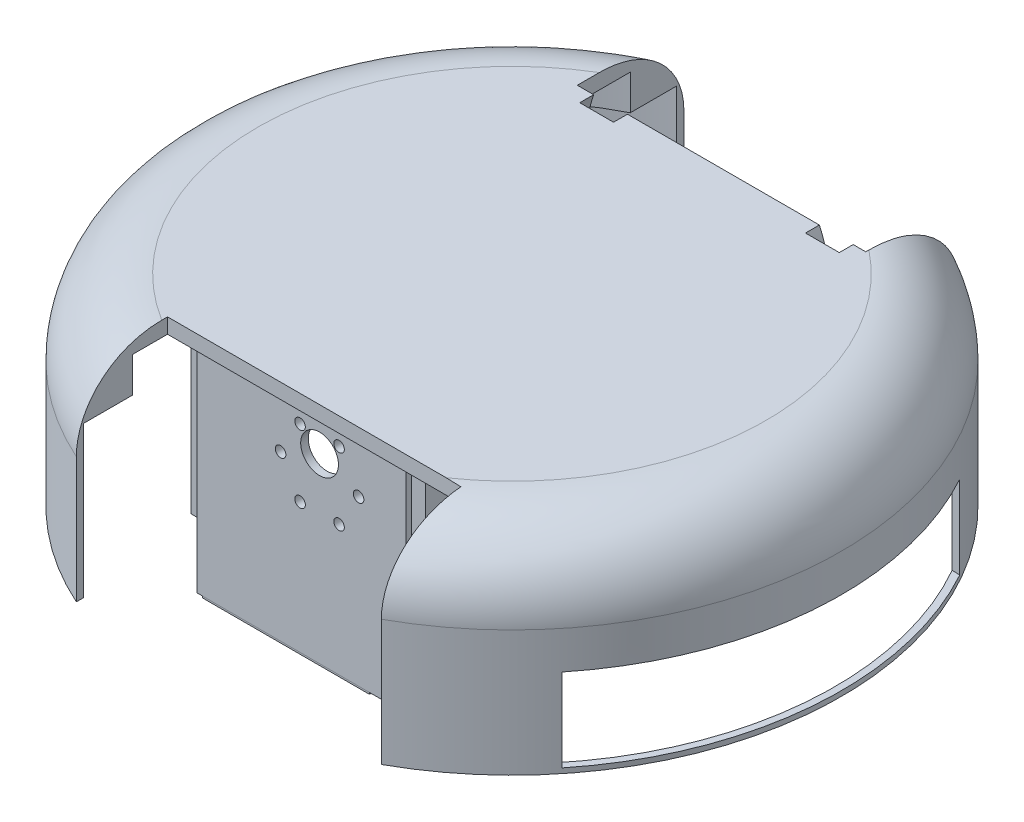
from build123d import *

# Parameters (mm, degrees)
MOTORHOLDERS_DEPTH               = 80
MOTORHOLDERS_DEPTH_BACK          = 80
MOTORHOLDERSSKETCH_R             = 23.41
SKETCH4_W                        = 262.774983374
SKETCH4_H                        = 153.112553215
CUT_EXTRUDE1_DEPTH               = 26
SKETCH53_R                       = 128.324079141
BOTTOMPLATECUTFORTHEINSIDE_DEPTH = 60
FILLET2_R                        = 30
SKETCH57_R                       = 110.374622245
CUTFORTHEINSIDE2_DEPTH           = 14
SKETCH23_W                       = 82.936115801
SKETCH23_H                       = 87.063331284
MOTORMOUNTINGSUPPORT1_DEPTH      = 6
SKETCH24_W                       = 62.643465408
SKETCH24_H                       = 86.363062387
MOTORMOUNTINGSUPPOR2_DEPTH       = 6
SKETCH17_R                       = 2.1
SKETCH17_R_2                     = 7.5
MOTORHOLES1_DEPTH                = 31.5
CUT_EXTRUDE4_START               = -30
SKETCH19_R                       = 2.1
SKETCH19_R_2                     = 7.5
CUT_EXTRUDE4_DEPTH               = 30
CELLPHONEPLATE_DEPTH             = 1.5
CELLPHONEPLATE_DEPTH_BACK        = 2.5
SKETCH28_W                       = 66.387115975
SKETCH28_H                       = 157.698901517
MOTORHOLDERCUT_DEPTH             = 77
MOTORHOLDERCUT_DEPTH_BACK        = 77
MOTORHOLDEREXTRUDESKETCH_R       = 20.415
SKETCH54_W                       = 14.905504957
SKETCH54_H                       = 17.743992054
SKETCH54_W_2                     = 11.623155669
SKETCH54_H_2                     = 15.406590489
SKETCH54_W_3                     = 15.41217296
SKETCH54_H_3                     = 20.336661001
SKETCH54_W_4                     = 14.995116458
SKETCH54_H_4                     = 28.496316742
BOSS_EXTRUDE12_DEPTH             = 60
POWERBANKCUT_DEPTH               = 33
CUT_EXTRUDE11_DEPTH              = 10
CUT_EXTRUDE11_DEPTH_BACK         = 5
SKETCH43_R                       = 54.5
SKETCH43_R_2                     = 42
WHEELOPENINGS_DEPTH              = 332.549853827
WHEELOPENINGS_DEPTH_BACK         = 332.549853827
SKETCH46_W                       = 116.594199343
SKETCH46_H                       = 125.693747757
SKETCH46_W_2                     = 114.657260807
SKETCH46_H_2                     = 111.481493264
CUT_EXTRUDE23_DEPTH              = 5
CUT_EXTRUDE23_DEPTH_BACK         = 45
SKETCH55_W                       = 110.87314981
SKETCH55_H                       = 156.298500792


with BuildPart() as part:
    # MotorHoldersSketch → MotorHolders (new, two sides: drawn at the far end of the back side and taken through both)
    with BuildSketch(Plane.XY.offset(-MOTORHOLDERS_DEPTH_BACK)):
        with Locations((170, 0)):
            Circle(MOTORHOLDERSSKETCH_R)
    extrude(amount=MOTORHOLDERS_DEPTH + MOTORHOLDERS_DEPTH_BACK)

    # Sketch4 → Cut-Extrude1 (cut)
    with BuildSketch(Plane(origin=(0, 0, 0), x_dir=(1, 0, 0), z_dir=(0, 1, 0))):
        with Locations((89.893628689, 0.176832173)):
            Rectangle(SKETCH4_W, SKETCH4_H)
    extrude(amount=-CUT_EXTRUDE1_DEPTH, mode=Mode.SUBTRACT)

    # BottomPlate: read off the stored shape, not the designer's step
    # BottomPlate: loft between two sections, ruled curve by curve
    bottomplate_from = [
        Edge.make_three_point_arc((163.830273897, -55.425, 128.360817568), (294.830273897, -55.425, -2.639182432), (163.830273897, -55.425, -133.639182432)),
        Edge.make_three_point_arc((163.830273897, -55.425, -133.639182432), (32.830273897, -55.425, -2.639182432), (163.830273897, -55.425, 128.360817568)),
    ]
    bottomplate_to = [
        Edge.make_three_point_arc((163.830273897, 24.575, 128.360817568), (294.830273897, 24.575, -2.639182432), (163.830273897, 24.575, -133.639182432)),
        Edge.make_three_point_arc((163.830273897, 24.575, -133.639182432), (32.830273897, 24.575, -2.639182432), (163.830273897, 24.575, 128.360817568)),
    ]
    bottomplate = Solid(Shell([*[Face.make_surface_from_curves(bottomplate_from[k], bottomplate_to[k]) for k in range(2)], Face(Wire(bottomplate_from)), Face(Wire(bottomplate_to))]))
    add(bottomplate)

    # Sketch53 → BottomPlateCutForTheInside (cut)
    with BuildSketch(Plane.XZ.offset(55.425)):
        with Locations(Location((163.830273897, -2.639182432, 0), (0, 0, 270))):
            Circle(SKETCH53_R)
    extrude(amount=-BOTTOMPLATECUTFORTHEINSIDE_DEPTH, mode=Mode.SUBTRACT)

    # Fillet2
    # the kernel refuses this fillet: 30 mm, written as the material it takes off along each edge
    with BuildSketch(Plane(origin=(163.830273897, 24.575, -2.639182432), x_dir=(0, 0, 1), z_dir=(-1, 0, 0))) as fillet2_piece_1:
        with BuildLine():
            CenterArc((131 - FILLET2_R * 1.00000000132, -FILLET2_R), FILLET2_R, 0, 90)
            Line((131 - FILLET2_R * 1.00000000132, 0), (131, 0))
            Line((131, 0), (131 - FILLET2_R * 1.32132337664e-09, -FILLET2_R))
        make_face()
    revolve(axis=Axis((163.830273897, 24.575, -2.639182432), (0, 1, 0)), revolution_arc=180, mode=Mode.SUBTRACT)
    with BuildSketch(Plane(origin=(163.830273897, 24.575, -2.639182432), x_dir=(0, 0, -1), z_dir=(1, 0, 0))) as fillet2_piece_2:
        with BuildLine():
            CenterArc((131 - FILLET2_R * 1.00000000132, -FILLET2_R), FILLET2_R, 0, 90)
            Line((131 - FILLET2_R * 1.00000000132, 0), (131, 0))
            Line((131, 0), (131 - FILLET2_R * 1.32132432403e-09, -FILLET2_R))
        make_face()
    revolve(axis=Axis((163.830273897, 24.575, -2.639182432), (0, 1, 0)), revolution_arc=180, mode=Mode.SUBTRACT)

    # Sketch57 → CutForTheInside2 (cut)
    with BuildSketch(Plane.XZ.offset(-4.575)):
        with Locations(Location((161.730665596, -3.091355915, 0), (0, 0, 270))):
            Circle(SKETCH57_R)
    extrude(amount=-CUTFORTHEINSIDE2_DEPTH, mode=Mode.SUBTRACT)

    # Sketch23 → MotorMountingSupport1 (add)
    with BuildSketch(Plane.XY.offset(80)):
        with Locations((162.789906406, -21.691470758)):
            Rectangle(SKETCH23_W, SKETCH23_H)
    extrude(amount=-MOTORMOUNTINGSUPPORT1_DEPTH)

    # Sketch24 → MotorMountingSuppor2 (add)
    with BuildSketch(Plane(origin=(0, 0, -80), x_dir=(-1, 0, 0), z_dir=(0, 0, -1))):
        with Locations((-170.868787608, -23.94412431)):
            Rectangle(SKETCH24_W, SKETCH24_H)
    extrude(amount=-MOTORMOUNTINGSUPPOR2_DEPTH)

    # Sketch17 → MotorHoles1 (cut)
    with BuildSketch(Plane.XY.offset(80)):
        with Locations((185.5, 0)):
            Circle(SKETCH17_R)
        with Locations((177.75, -13.42)):
            Circle(SKETCH17_R)
        with Locations((162.25, -13.42)):
            Circle(SKETCH17_R)
        with Locations((154.5, 0)):
            Circle(SKETCH17_R)
        with Locations((162.25, 13.42)):
            Circle(SKETCH17_R)
        with Locations((177.75, 13.42)):
            Circle(SKETCH17_R)
        with Locations((170, 7)):
            Circle(SKETCH17_R_2)
    extrude(amount=-MOTORHOLES1_DEPTH, mode=Mode.SUBTRACT)

    # Sketch19 → Cut-Extrude4 (cut)
    with BuildSketch(Plane(origin=(0, 0, -80), x_dir=(-1, 0, 0), z_dir=(0, 0, -1)).offset(CUT_EXTRUDE4_START)):
        with Locations(Location((-185.5, 0, 0), (0, 0, 180))):
            Circle(SKETCH19_R)
        with Locations(Location((-177.75, -13.42, 0), (0, 0, 180))):
            Circle(SKETCH19_R)
        with Locations(Location((-162.25, -13.42, 0), (0, 0, 180))):
            Circle(SKETCH19_R)
        with Locations(Location((-154.5, 0, 0), (0, 0, 180))):
            Circle(SKETCH19_R)
        with Locations(Location((-162.25, 13.42, 0), (0, 0, 180))):
            Circle(SKETCH19_R)
        with Locations(Location((-177.75, 13.42, 0), (0, 0, 180))):
            Circle(SKETCH19_R)
        with Locations(Location((-170, 7, 0), (0, 0, 180))):
            Circle(SKETCH19_R_2)
    extrude(amount=CUT_EXTRUDE4_DEPTH, mode=Mode.SUBTRACT)

    # Sketch28 → CellPhonePlate (add, two sides: drawn at the far end of the back side and taken through both)
    with BuildSketch(Plane(origin=(0, -64.829272125, 0), x_dir=(-1, 0, 0), z_dir=(0, -1, 0)).offset(-CELLPHONEPLATE_DEPTH_BACK)):
        with Locations((-156.196154729, -0.699595313)):
            Rectangle(SKETCH28_W, SKETCH28_H)
    extrude(amount=CELLPHONEPLATE_DEPTH + CELLPHONEPLATE_DEPTH_BACK)

    # MotorHolderExtrudeSketch → MotorHolderCut (cut, two sides: drawn at the far end of the back side and taken through both)
    with BuildSketch(Plane.XY.offset(-MOTORHOLDERCUT_DEPTH_BACK)):
        with Locations((170, 0)):
            Circle(MOTORHOLDEREXTRUDESKETCH_R)
    extrude(amount=MOTORHOLDERCUT_DEPTH + MOTORHOLDERCUT_DEPTH_BACK, mode=Mode.SUBTRACT)

    # Sketch54 → Boss-Extrude12 (add)
    with BuildSketch(Plane.XZ.offset(-18.575)):
        with Locations((206.988441473, -69.206857561)):
            Rectangle(SKETCH54_W, SKETCH54_H)
        with Locations((138.923219907, -69.336411659)):
            Rectangle(SKETCH54_W_2, SKETCH54_H_2)
        with Locations((202.073699031, 67.602556792)):
            Rectangle(SKETCH54_W_3, SKETCH54_H_3)
        with Locations((124.209409668, 63.522728921)):
            Rectangle(SKETCH54_W_4, SKETCH54_H_4)
    extrude(amount=BOSS_EXTRUDE12_DEPTH)

    # Sketch11 → PowerBankCut (cut)
    with BuildSketch(Plane(origin=(0, -20.425, 0), x_dir=(1, 0, 0), z_dir=(0, 1, 0))):
        Polygon((55.038885452, -72.893378905), (55.038885452, 75.050788564), (295.013044953, 65.256410745), (295.013044953, -80.378817854), align=None)
    extrude(amount=-POWERBANKCUT_DEPTH, mode=Mode.SUBTRACT)

    # Sketch43 → Cut-Extrude11 (cut, two sides: drawn at the far end of the back side and taken through both)
    with BuildSketch(Plane(origin=(0, 0, -80), x_dir=(-1, 0, 0), z_dir=(0, 0, -1)).offset(-CUT_EXTRUDE11_DEPTH_BACK)):
        with Locations((-170, 7)):
            Circle(SKETCH43_R)
        with Locations((-170, 7)):
            Circle(SKETCH43_R_2, mode=Mode.SUBTRACT)
    extrude(amount=CUT_EXTRUDE11_DEPTH + CUT_EXTRUDE11_DEPTH_BACK, mode=Mode.SUBTRACT)

    # Sketch46 → WheelOpenings (cut, two sides: drawn at the far end of the back side and taken through both)
    with BuildSketch(Plane.XZ.offset(-4.575).offset(-WHEELOPENINGS_DEPTH_BACK)):
        with Locations((168.496318976, 143.484991478)):
            Rectangle(SKETCH46_W, SKETCH46_H)
        with Locations((169.250548927, -136.266708486)):
            Rectangle(SKETCH46_W_2, SKETCH46_H_2)
    extrude(amount=WHEELOPENINGS_DEPTH + WHEELOPENINGS_DEPTH_BACK, mode=Mode.SUBTRACT)

    # Sketch55 → Cut-Extrude23 (cut, two sides: drawn at the far end of the back side and taken through both)
    with BuildSketch(Plane.XZ.offset(55.425).offset(-CUT_EXTRUDE23_DEPTH_BACK)):
        with Locations((26.721027651, 1.567221761)):
            Rectangle(SKETCH55_W, SKETCH55_H)
    extrude(amount=CUT_EXTRUDE23_DEPTH + CUT_EXTRUDE23_DEPTH_BACK, mode=Mode.SUBTRACT)


solid = part.part
